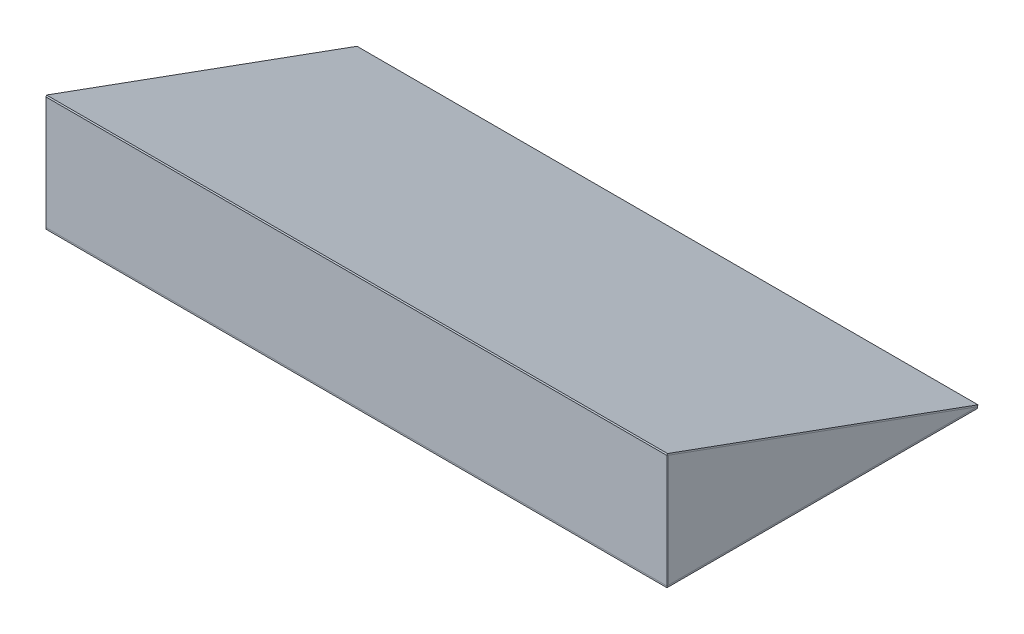
from build123d import *

# Parameters (mm, degrees)
SZKIC2_W               = 150
SZKIC2_H               = 0.7366
ODGI_CIE_BAZOWE1_DEPTH = 300
ODGI_CIE_BAZOWE2_DEPTH = 300
SZKIC10_W              = 0.7366
SZKIC10_H              = 54.59553514
ODGI_CIE_BAZOWE3_DEPTH = 300
ODGI_CIE_BAZOWE4_DEPTH = 0.7366
ODGI_CIE_BAZOWE5_DEPTH = 0.7366


# Sheet-metal steps are written as plain solids
with BuildPart() as part:
    # Szkic2 → Odgięcie bazowe1 (new body)
    with BuildSketch(Plane(origin=(0, 0, 0), x_dir=(0, 0, -1), z_dir=(1, 0, 0))):
        with Locations((75, -0.3683)):
            Rectangle(SZKIC2_W, SZKIC2_H)
    extrude(amount=ODGI_CIE_BAZOWE1_DEPTH)


with BuildPart() as body_2:
    # Szkic7 → Odgięcie bazowe2 (new body)
    with BuildSketch(Plane(origin=(0, 0, 0), x_dir=(0, 0, -1), z_dir=(1, 0, 0))):
        Polygon((150, 0), (0, 54.59553514), (0.251932038, 55.287712724), (150.251932038, 0.692177584), align=None)
    extrude(amount=ODGI_CIE_BAZOWE2_DEPTH)


with BuildPart() as body_3:
    # Szkic10 → Odgięcie bazowe3 (new body)
    with BuildSketch(Plane(origin=(0, 0, 0), x_dir=(0, 0, -1), z_dir=(1, 0, 0))):
        with Locations((0.3683, 27.29776757)):
            Rectangle(SZKIC10_W, SZKIC10_H)
    extrude(amount=ODGI_CIE_BAZOWE3_DEPTH)


with BuildPart() as body_4:
    # Szkic15 → Odgięcie bazowe4 (new body)
    with BuildSketch(Plane.ZY):
        Polygon((-0.7366, 54.59553514), (-150, 0), (-0.7366, 0), align=None)
    extrude(amount=-ODGI_CIE_BAZOWE4_DEPTH)


with BuildPart() as body_5:
    # Szkic18 → Odgięcie bazowe5 (new body)
    with BuildSketch(Plane(origin=(300, 0, 0), x_dir=(0, 0, -1), z_dir=(1, 0, 0))):
        Polygon((0.7366, 0), (0.7366, 54.59553514), (150, 0), align=None)
    extrude(amount=-ODGI_CIE_BAZOWE5_DEPTH)


solid = Compound([part.part, body_2.part, body_3.part, body_4.part, body_5.part])
